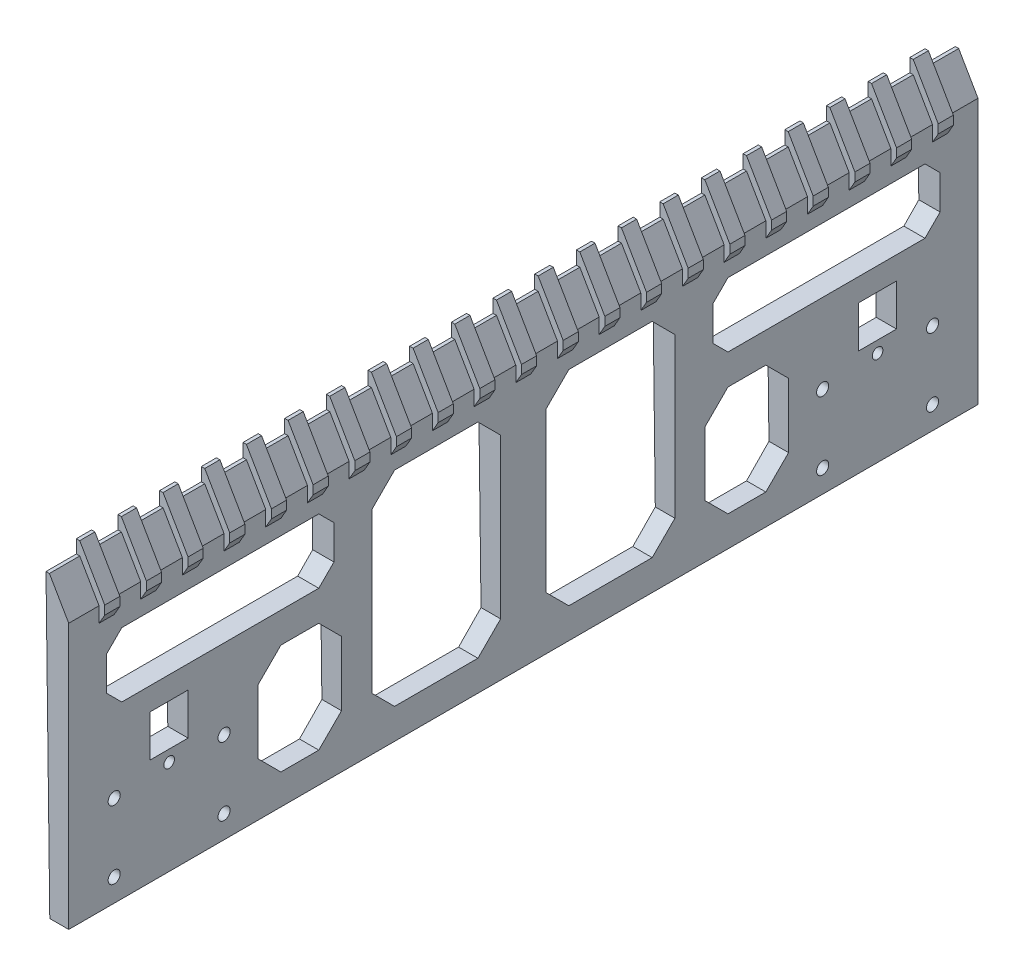
from build123d import *

# Parameters (mm, degrees)
SKETCH_1_W                  = 240
SKETCH_1_H                  = 70
EXTRUDE_1_DEPTH             = 6
CUT_EXTRUDE_2_DEPTH         = 251.071989635
EXTRUDE_2_DEPTH             = 240
EXTRUDE_3_DEPTH             = 2
PATTERN_LINEAR_1_COUNT      = 11
PATTERN_LINEAR_1_PITCH      = 11
PATTERN_LINEAR_1_COUNT_DIR2 = 11
PATTERN_LINEAR_1_PITCH_DIR2 = 11
HOLE_WIZARD_1_D             = 3.2
HOLE_WIZARD_1_CBORE_D       = 6
HOLE_WIZARD_1_CBORE_DEPTH   = 3.4
SKETCH_16_R                 = 1.4
CUT_EXTRUDE_3_DEPTH         = 10
SKETCH_17_W                 = 10
SKETCH_17_H                 = 11
CUT_EXTRUDE_4_DEPTH         = 251.112474699
CUT_EXTRUDE_5_REACH         = 252.112


with BuildPart() as part:
    # 草图1 → 凸台-拉伸1 (new body)
    with BuildSketch(Plane(origin=(0, 0, 0), x_dir=(0, 0, -1), z_dir=(1, 0, 0))):
        with Locations((120, -35)):
            Rectangle(SKETCH_1_W, SKETCH_1_H)
    extrude(amount=EXTRUDE_1_DEPTH)

    # 草图3 → 切除-拉伸2 (cut, through all)
    with BuildSketch(Plane(origin=(6, 0, 0), x_dir=(0, 0, -1), z_dir=(1, 0, 0))):
        Polygon((14, -8), (66, -8), (70, -12), (70, -21), (66, -25), (14, -25), (10, -21), (10, -12), align=None)
        Polygon((80, -14), (86, -8), (108, -8), (114, -14), (114, -56), (108, -62), (86, -62), (80, -56), align=None)
        Polygon((50, -56), (56, -62), (66, -62), (72, -56), (72, -39), (66, -33), (56, -33), (50, -39), align=None)
    cut_extrude_2 = extrude(amount=-CUT_EXTRUDE_2_DEPTH, mode=Mode.SUBTRACT)

    # 草图6 → 凸台-拉伸2 (add)
    with BuildSketch(Plane.XY):
        Polygon((6, 0), (0, 0), (0, 8.833459119), (0.9, 8.833459119), align=None)
    extrude(amount=-EXTRUDE_2_DEPTH)

    # 草图8 → 凸台-拉伸3 (add, symmetric)
    with BuildSketch(Plane.XY.offset(-120)):
        Polygon((0, 10.392304845), (0, 12.333459119), (0.9, 12.333459119), (7.5, 0.901923789), (7.5, -1.401923789), (6, -4), (6, 0), (0.9, 8.833459119), (0, 8.833459119), align=None)
    extrude_3 = extrude(amount=EXTRUDE_3_DEPTH, both=True)

    # 阵列(线性)1: Extrude 3 11 × 11
    with Locations(*[Vector(0, 0, 1) * (i * PATTERN_LINEAR_1_PITCH) + Vector(0, 0, -1) * (j * PATTERN_LINEAR_1_PITCH_DIR2) for i in range(PATTERN_LINEAR_1_COUNT) for j in range(PATTERN_LINEAR_1_COUNT_DIR2) if (i, j) != (0, 0)]):
        add(extrude_3)

    # 打孔尺寸(%根据)内六角圆柱头螺钉的类型1 (through all)
    with Locations(Plane.ZY):
        with Locations((-41, -46), (-12, -46), (-12, -64), (-41, -64)):
            hole_wizard_1 = CounterBoreHole(HOLE_WIZARD_1_D / 2, HOLE_WIZARD_1_CBORE_D / 2, HOLE_WIZARD_1_CBORE_DEPTH)

    # 草图16 → 切除-拉伸3 (cut)
    with BuildSketch(Plane.ZY):
        with Locations((-26.5, -45.023268437)):
            Circle(SKETCH_16_R)
    cut_extrude_3 = extrude(amount=-CUT_EXTRUDE_3_DEPTH, mode=Mode.SUBTRACT)

    # 镜向1: 打孔尺寸(%根据)内六角圆柱头螺钉的类型1 across plane
    add(hole_wizard_1.mirror(Plane.XY.offset(-120)), mode=Mode.SUBTRACT)

    # 镜向2: 切除-拉伸2, 切除-拉伸3 across plane
    add(cut_extrude_2.mirror(Plane.XY.offset(-120)), mode=Mode.SUBTRACT)
    add(cut_extrude_3.mirror(Plane.XY.offset(-120)), mode=Mode.SUBTRACT)

    # 草图17 → 切除-拉伸4 (cut, through all)
    with BuildSketch(Plane.ZY):
        with Locations((-26.5, -36.5)):
            Rectangle(SKETCH_17_W, SKETCH_17_H)
        with Locations((-213.5, -36.5)):
            Rectangle(SKETCH_17_W, SKETCH_17_H)
    extrude(amount=-CUT_EXTRUDE_4_DEPTH, mode=Mode.SUBTRACT)

    # 草图18 → 切除-拉伸5 (cut, up to next)
    with BuildSketch(Plane.XY, mode=Mode.PRIVATE) as cut_extrude_5_sk1:
        Polygon((0, -70), (1, -70), (0, 8.833459119), align=None)
    cut_extrude_5_tool1 = extrude(cut_extrude_5_sk1.sketch, amount=-CUT_EXTRUDE_5_REACH, mode=Mode.PRIVATE) & part.part
    add(cut_extrude_5_tool1.solids().sort_by_distance((0.333333, -43.72218, 0))[0], mode=Mode.SUBTRACT)


solid = part.part
